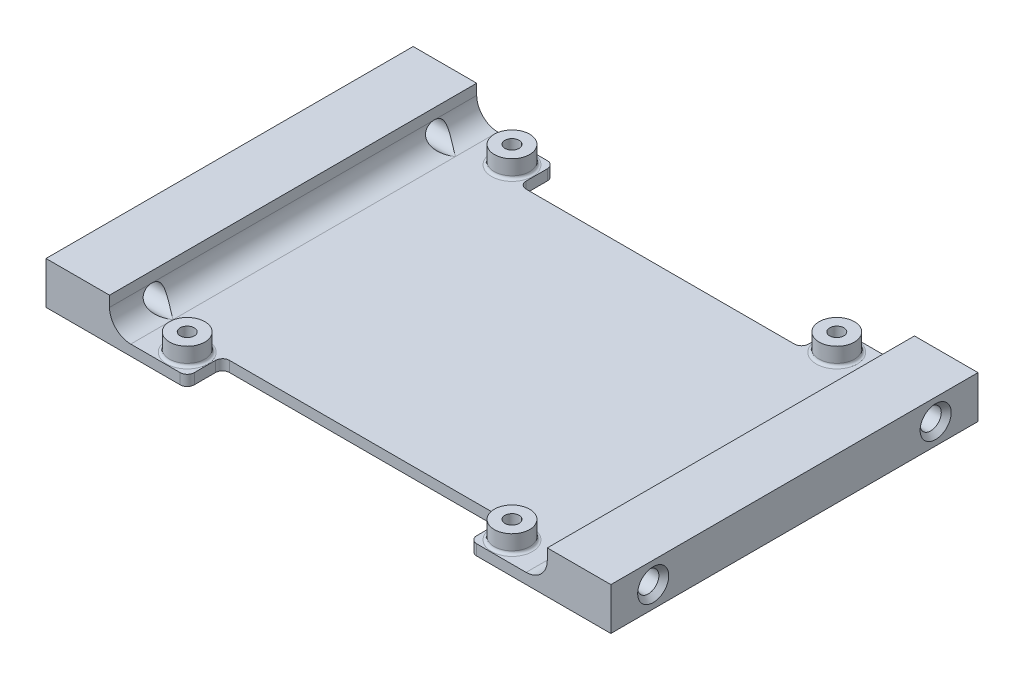
from build123d import *
from build123d.topology import SkipClean

# Parameters (mm, degrees)
AUFSATZ_LINEAR_AUSTRAGEN1_DEPTH         = 3
AUFSATZ_LINEAR_AUSTRAGEN1_DEPTH_BACK    = 3
SKIZZE1_W                               = 80
SKIZZE1_H                               = 52
F_3_0_3_DURCHMESSER_BOHRUNG1_AT_2_COUNT = 2
F_3_0_3_DURCHMESSER_BOHRUNG1_AT_2_PITCH = 40
SKIZZE4_W                               = 62
SKIZZE4_H                               = 52
SCHNITT_LINEAR_AUSTRAGEN1_DEPTH         = 4.5
SKIZZE8_R                               = 2.5
AUFSATZ_LINEAR_AUSTRAGEN2_DEPTH         = 2.5
SKIZZE9_R                               = 1
SCHNITT_LINEAR_AUSTRAGEN5_DEPTH         = 48.874836814
SKIZZE11_W                              = 40
SKIZZE11_H                              = 5
SCHNITT_LINEAR_AUSTRAGEN6_DEPTH         = 48.801673611
VERRUNDUNG2_R                           = 0.4
FASE1_SIZE                              = 0.7
VERRUNDUNG4_R                           = 1
VERRUNDUNG5_START                       = -26
VERRUNDUNG5_DEPTH                       = 52
VERRUNDUNG5_START_2                     = 27.9999999
VERRUNDUNG5_2_OUTLINE_R                 = 1.5
VERRUNDUNG5_2_DEPTH                     = 3.0000001
VERRUNDUNG5_START_3                     = -31
VERRUNDUNG5_3_OUTLINE_R                 = 1.5
VERRUNDUNG5_3_DEPTH                     = 3


with BuildPart() as part:
    # Skizze1 → Aufsatz-Linear austragen1 (new, two sides: drawn at the far end of the back side and taken through both)
    with BuildSketch(Plane(origin=(0, 0, 0), x_dir=(1, 0, 0), z_dir=(0, 1, 0)).offset(-AUFSATZ_LINEAR_AUSTRAGEN1_DEPTH_BACK)):
        Rectangle(SKIZZE1_W, SKIZZE1_H)
    extrude(amount=AUFSATZ_LINEAR_AUSTRAGEN1_DEPTH + AUFSATZ_LINEAR_AUSTRAGEN1_DEPTH_BACK)

    # Skizze2 → Ø3.0 (3) Durchmesser Bohrung1 (revolve, cut)
    with BuildSketch(Plane(origin=(40, 0, 20), x_dir=(0, 0, -1), z_dir=(0, 1, 0))):
        Polygon((0, 0), (0, 10.901290929), (1.5, 10), (1.5, 0), align=None)
    f_3_0_3_durchmesser_bohrung1 = revolve(axis=Axis((46.35, 0, 20), (-1, 0, 0)), mode=Mode.SUBTRACT)

    # Ø3.0 (3) Durchmesser Bohrung1 at 2: Ø3.0 (3) Durchmesser Bohrung1 ×2
    with Locations(*[(0, 0, -i * F_3_0_3_DURCHMESSER_BOHRUNG1_AT_2_PITCH) for i in range(1, F_3_0_3_DURCHMESSER_BOHRUNG1_AT_2_COUNT)]):
        add(f_3_0_3_durchmesser_bohrung1, mode=Mode.SUBTRACT)

    # Spiegeln1: Ø3.0 (3) Durchmesser Bohrung1 across plane
    add(f_3_0_3_durchmesser_bohrung1.mirror(Plane(origin=(0, 0, 0), x_dir=(0, 0, 1), z_dir=(1, 0, 0))), mode=Mode.SUBTRACT)

    # Spiegeln1 copy 1 sketch → Spiegeln1 copy 1 (revolve, cut)
    with BuildSketch(Plane(origin=(-40, 0, -20), x_dir=(0, 0, -1), z_dir=(0, 1, 0))):
        Polygon((0, 0), (0, -10.901290929), (1.5, -10), (1.5, 0), align=None)
    revolve(axis=Axis((-46.35, 0, -20), (-1, 0, 0)), mode=Mode.SUBTRACT)

    # Skizze4 → Schnitt-Linear austragen1 (cut)
    with BuildSketch(Plane(origin=(0, 3, 0), x_dir=(1, 0, 0), z_dir=(0, 1, 0))):
        Rectangle(SKIZZE4_W, SKIZZE4_H)
    extrude(amount=-SCHNITT_LINEAR_AUSTRAGEN1_DEPTH, mode=Mode.SUBTRACT)

    # Skizze8 → Aufsatz-Linear austragen2 (add)
    with BuildSketch(Plane(origin=(0, -1.5, 0), x_dir=(1, 0, 0), z_dir=(0, 1, 0))):
        with Locations(Location((-23, 23, 0), (0, 0, 270))):
            Circle(SKIZZE8_R)
        with Locations(Location((23, 23, 0), (0, 0, 90))):
            Circle(SKIZZE8_R)
        with Locations(Location((23, -23, 0), (0, 0, 270))):
            Circle(SKIZZE8_R)
        with Locations(Location((-23, -23, 0), (0, 0, 90))):
            Circle(SKIZZE8_R)
    extrude(amount=AUFSATZ_LINEAR_AUSTRAGEN2_DEPTH)

    # Skizze9 → Schnitt-Linear austragen5 (cut, through all)
    with BuildSketch(Plane(origin=(0, 1, 0), x_dir=(1, 0, 0), z_dir=(0, 1, 0))):
        with Locations(Location((-23, 23, 0), (0, 0, 270))):
            Circle(SKIZZE9_R)
        with Locations(Location((23, 23, 0), (0, 0, 270))):
            Circle(SKIZZE9_R)
        with Locations(Location((23, -23, 0), (0, 0, 270))):
            Circle(SKIZZE9_R)
        with Locations(Location((-23, -23, 0), (0, 0, 270))):
            Circle(SKIZZE9_R)
    extrude(amount=-SCHNITT_LINEAR_AUSTRAGEN5_DEPTH, mode=Mode.SUBTRACT)

    # Skizze11 → Schnitt-Linear austragen6 (cut, through all)
    with BuildSketch(Plane(origin=(0, 0, 0), x_dir=(1, 0, 0), z_dir=(0, 1, 0))):
        with Locations((0, 23.5)):
            Rectangle(SKIZZE11_W, SKIZZE11_H)
        with Locations((0, -23.5)):
            Rectangle(SKIZZE11_W, SKIZZE11_H)
    extrude(amount=-SCHNITT_LINEAR_AUSTRAGEN6_DEPTH, mode=Mode.SUBTRACT)

    # Verrundung2
    verrundung2_edges = [part.edges().sort_by_distance(p)[0] for p in [
        (-23, -1.5, -25.5),
        (23, -1.5, -20.5),
        (23, -1.5, 20.5),
        (-23, -1.5, 25.5),
    ]]
    fillet(verrundung2_edges, radius=VERRUNDUNG2_R)

    # Fase1
    fase1_edges = [part.edges().sort_by_distance(p)[0] for p in [
        (40, 0, -18.5),
        (40, 0, 21.5),
        (-40, 0, -18.5),
        (-40, 0, 21.5),
    ]]
    chamfer(fase1_edges, length=FASE1_SIZE)

    # Verrundung4
    verrundung4_edges = [part.edges().sort_by_distance(p)[0] for p in [
        (-20, -2.25, -26),
        (20, -2.25, -26),
        (20, -2.25, -21),
        (-20, -2.25, -21),
        (20, -2.25, 26),
        (-20, -2.25, 26),
        (-20, -2.25, 21),
        (20, -2.25, 21),
    ]]
    fillet(verrundung4_edges, radius=VERRUNDUNG4_R)

    # Verrundung5: read off the stored shape, not the designer's step
    # Verrundung5 outline → Verrundung5 (add)
    with BuildSketch(Plane.XY.offset(VERRUNDUNG5_START)):
        with BuildLine():
            Line((-31, -1.5), (-28, -1.5))
            ThreePointArc((-28, -1.5), (-30.121321071, -0.621319616), (-31, 1.500002057))
            Line((-31, 1.500002057), (-31, -1.5))
        make_face()
        with BuildLine():
            ThreePointArc((31, 1.500002057), (30.121321071, -0.621319616), (28, -1.5))
            Line((28, -1.5), (31, -1.5))
            Line((31, -1.5), (31, 1.500002057))
        make_face()
    extrude(amount=VERRUNDUNG5_DEPTH)

    # Verrundung5 2 outline → Verrundung5 2 (cut)
    with BuildSketch(Plane.YZ.offset(VERRUNDUNG5_START_2)):
        with Locations((0, -20)):
            Circle(VERRUNDUNG5_2_OUTLINE_R)
        with Locations((0, 20)):
            Circle(VERRUNDUNG5_2_OUTLINE_R)
    extrude(amount=VERRUNDUNG5_2_DEPTH, mode=Mode.SUBTRACT)

    # Verrundung5 3 outline → Verrundung5 3 (cut)
    with SkipClean():  # the faces are left unmerged after this step: merging them gives an invalid solid
        with BuildSketch(Plane.YZ.offset(VERRUNDUNG5_START_3)):
            with Locations((0, -20)):
                Circle(VERRUNDUNG5_3_OUTLINE_R)
            with Locations((0, 20)):
                Circle(VERRUNDUNG5_3_OUTLINE_R)
        extrude(amount=VERRUNDUNG5_3_DEPTH, mode=Mode.SUBTRACT)


solid = part.part
